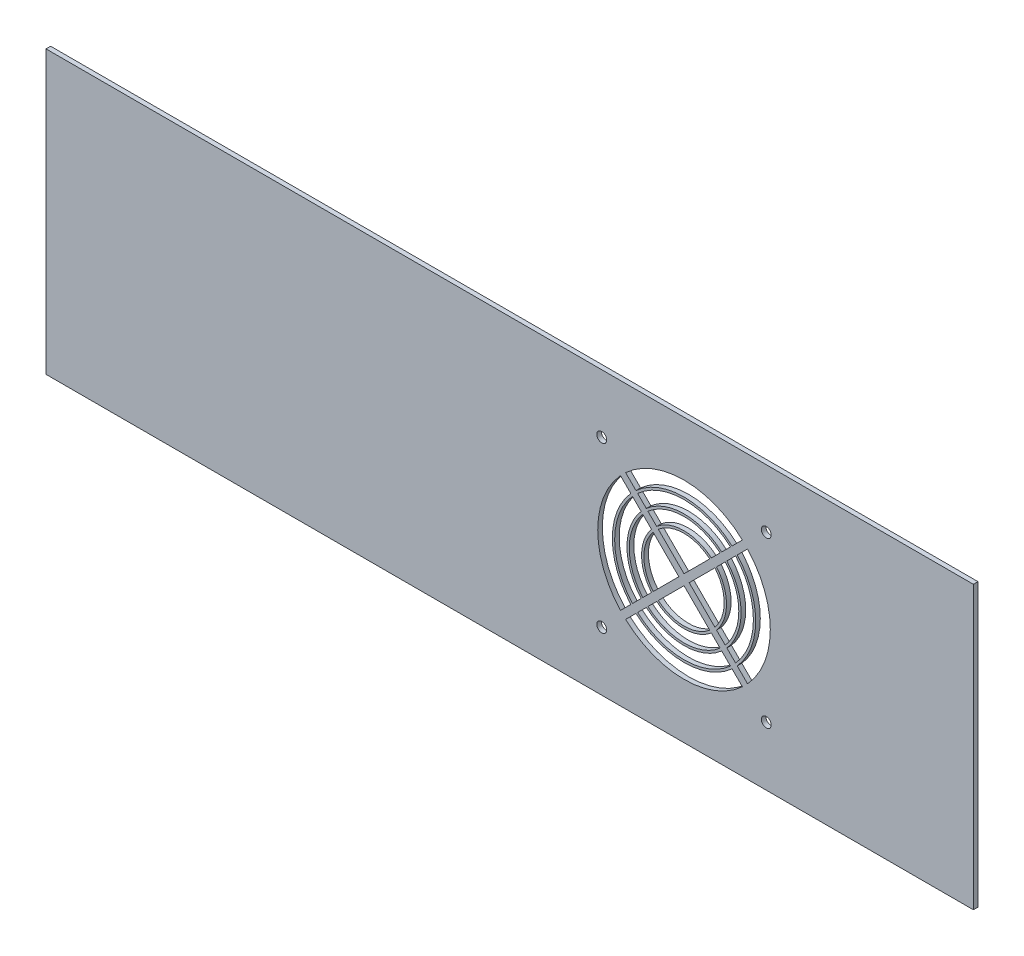
from build123d import *

# Parameters (mm, degrees)
SKETCH1_W           = 403
SKETCH1_H           = 122.5
SKETCH1_R           = 2.15
BOSS_EXTRUDE1_DEPTH = 2


with BuildPart() as part:
    # Sketch1 → Boss-Extrude1 (new body)
    with BuildSketch(Plane.XY):
        with Locations((201.5, -61.25)):
            Rectangle(SKETCH1_W, SKETCH1_H)
        with BuildLine():
            Line((300.370483971, -40.274997701), (304.865506227, -35.780060784))
            ThreePointArc((304.865506227, -35.780060784), (314.749999998, -61.150355981), (304.865024558, -86.520463509))
            Line((304.865024558, -86.520463509), (300.370087641, -82.025441252))
            ThreePointArc((300.370087641, -82.025441252), (308.399999999, -61.150295702), (300.370483971, -40.274997701))
        make_face(mode=Mode.SUBTRACT)
        with BuildLine():
            Line((295.872970965, -44.772425319), (299.662419836, -40.983048393))
            ThreePointArc((299.662419836, -40.983048393), (307.399999999, -61.150286209), (299.662036949, -81.317377117))
            Line((299.662036949, -81.317377117), (295.872660023, -77.527928247))
            ThreePointArc((295.872660023, -77.527928247), (302.049999999, -61.150235422), (295.872970965, -44.772425319))
        make_face(mode=Mode.SUBTRACT)
        with BuildLine():
            Line((291.370381927, -49.274928874), (295.164343031, -45.4810398))
            ThreePointArc((295.164343031, -45.4810398), (301.049999999, -61.150225929), (295.164045543, -76.819300313))
            Line((295.164045543, -76.819300313), (291.370156468, -73.025339208))
            ThreePointArc((291.370156468, -73.025339208), (295.699999999, -61.150175143), (291.370381927, -49.274928874))
        make_face(mode=Mode.SUBTRACT)
        with BuildLine():
            Line((279.49506403, -61.150021312), (290.660484516, -49.984812807))
            ThreePointArc((290.660484516, -49.984812807), (294.699999999, -61.15016565), (290.660272535, -72.315441798))
            Line((290.660272535, -72.315441798), (279.49506403, -61.150021312))
        make_face(mode=Mode.SUBTRACT)
        with BuildLine():
            Line((288.415441798, -47.739727465), (277.250021312, -58.90493597))
            Line((277.250021312, -58.90493597), (266.084812807, -47.739515484))
            ThreePointArc((266.084812807, -47.739515484), (277.25016565, -43.700000001), (288.415441798, -47.739727465))
        make_face(mode=Mode.SUBTRACT)
        with BuildLine():
            Line((292.919300313, -43.235954457), (289.125339208, -47.029843532))
            ThreePointArc((289.125339208, -47.029843532), (277.250175143, -42.700000001), (265.374928874, -47.029618073))
            Line((265.374928874, -47.029618073), (261.5810398, -43.235656969))
            ThreePointArc((261.5810398, -43.235656969), (277.250225929, -37.350000001), (292.919300313, -43.235954457))
        make_face(mode=Mode.SUBTRACT)
        with BuildLine():
            Line((297.417377117, -38.737963051), (293.627928247, -42.527339977))
            ThreePointArc((293.627928247, -42.527339977), (277.250235422, -36.350000001), (260.872425319, -42.527029035))
            Line((260.872425319, -42.527029035), (257.083048393, -38.737580164))
            ThreePointArc((257.083048393, -38.737580164), (277.250286209, -31.000000001), (297.417377117, -38.737963051))
        make_face(mode=Mode.SUBTRACT)
        with BuildLine():
            Line((302.620463509, -33.534975442), (298.125441252, -38.029912359))
            ThreePointArc((298.125441252, -38.029912359), (277.250295702, -30.000000001), (256.374997701, -38.029516029))
            Line((256.374997701, -38.029516029), (251.880060784, -33.534493773))
            ThreePointArc((251.880060784, -33.534493773), (277.250355981, -23.650000002), (302.620463509, -33.534975442))
        make_face(mode=Mode.SUBTRACT)
        with Locations((241.5, -96.9)):
            Circle(SKETCH1_R, mode=Mode.SUBTRACT)
        with Locations((313, -96.9)):
            Circle(SKETCH1_R, mode=Mode.SUBTRACT)
        with BuildLine():
            ThreePointArc((249.634493773, -86.519939216), (239.750000002, -61.149644019), (249.634975442, -35.779536491))
            Line((249.634975442, -35.779536491), (254.129912359, -40.274558748))
            ThreePointArc((254.129912359, -40.274558748), (246.100000001, -61.149704298), (254.129516029, -82.025002299))
            Line((254.129516029, -82.025002299), (249.634493773, -86.519939216))
        make_face(mode=Mode.SUBTRACT)
        with BuildLine():
            ThreePointArc((302.619939216, -88.765506227), (277.249644019, -98.649999998), (251.879536491, -88.765024558))
            Line((251.879536491, -88.765024558), (256.374558748, -84.270087641))
            ThreePointArc((256.374558748, -84.270087641), (277.249704298, -92.299999999), (298.125002299, -84.270483971))
            Line((298.125002299, -84.270483971), (302.619939216, -88.765506227))
        make_face(mode=Mode.SUBTRACT)
        with Locations((313, -25.4)):
            Circle(SKETCH1_R, mode=Mode.SUBTRACT)
        with Locations((241.5, -25.4)):
            Circle(SKETCH1_R, mode=Mode.SUBTRACT)
        with BuildLine():
            Line((254.837963051, -40.982622883), (258.627339977, -44.772071753))
            ThreePointArc((258.627339977, -44.772071753), (252.450000001, -61.149764578), (258.627029035, -77.527574681))
            Line((258.627029035, -77.527574681), (254.837580164, -81.316951607))
            ThreePointArc((254.837580164, -81.316951607), (247.100000001, -61.149713791), (254.837963051, -40.982622883))
        make_face(mode=Mode.SUBTRACT)
        with BuildLine():
            Line((263.839727465, -49.984558202), (275.00493597, -61.149978688))
            Line((275.00493597, -61.149978688), (263.839515484, -72.315187193))
            ThreePointArc((263.839515484, -72.315187193), (259.800000001, -61.14983435), (263.839727465, -49.984558202))
        make_face(mode=Mode.SUBTRACT)
        with BuildLine():
            Line((259.335954457, -45.480699687), (263.129843532, -49.274660792))
            ThreePointArc((263.129843532, -49.274660792), (258.800000001, -61.149824857), (263.129618073, -73.025071126))
            Line((263.129618073, -73.025071126), (259.335656969, -76.8189602))
            ThreePointArc((259.335656969, -76.8189602), (253.450000001, -61.149774071), (259.335954457, -45.480699687))
        make_face(mode=Mode.SUBTRACT)
        with BuildLine():
            Line((266.084558202, -74.560272535), (277.249978688, -63.39506403))
            Line((277.249978688, -63.39506403), (288.415187193, -74.560484516))
            ThreePointArc((288.415187193, -74.560484516), (277.24983435, -78.599999999), (266.084558202, -74.560272535))
        make_face(mode=Mode.SUBTRACT)
        with BuildLine():
            Line((261.580699687, -79.064045543), (265.374660792, -75.270156468))
            ThreePointArc((265.374660792, -75.270156468), (277.249824857, -79.599999999), (289.125071126, -75.270381927))
            Line((289.125071126, -75.270381927), (292.9189602, -79.064343031))
            ThreePointArc((292.9189602, -79.064343031), (277.249774071, -84.949999999), (261.580699687, -79.064045543))
        make_face(mode=Mode.SUBTRACT)
        with BuildLine():
            Line((257.082622883, -83.562036949), (260.872071753, -79.772660023))
            ThreePointArc((260.872071753, -79.772660023), (277.249764578, -85.949999999), (293.627574681, -79.772970965))
            Line((293.627574681, -79.772970965), (297.416951607, -83.562419836))
            ThreePointArc((297.416951607, -83.562419836), (277.249713791, -91.299999999), (257.082622883, -83.562036949))
        make_face(mode=Mode.SUBTRACT)
    extrude(amount=BOSS_EXTRUDE1_DEPTH)


solid = part.part
